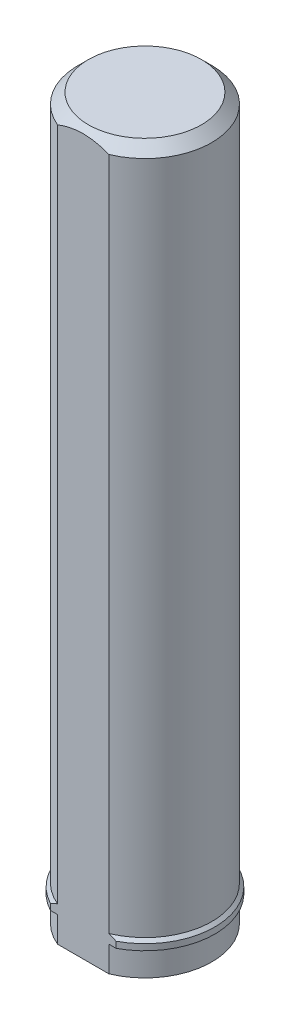
from build123d import *

# Parameters (mm, degrees)
BOSS_EXTRUDE1_DEPTH = 17.5
BOSS_EXTRUDE2_START = -1.75
BOSS_EXTRUDE2_DEPTH = 0.5
CHAMFER1_SIZE       = 0.2


with BuildPart() as part:
    # Sketch1 → Boss-Extrude1 (new, symmetric)
    with BuildSketch(Plane(origin=(0, 0, 0), x_dir=(1, 0, 0), z_dir=(0, 1, 0))):
        with BuildLine():
            Line((-1.25, -3), (1.25, -3))
            ThreePointArc((1.25, -3), (0, 3.25), (-1.25, -3))
        make_face()
    extrude(amount=BOSS_EXTRUDE1_DEPTH, both=True)

    # Sketch2 → Boss-Extrude2 (add)
    with BuildSketch(Plane.XZ.offset(17.5).offset(BOSS_EXTRUDE2_START)):
        with BuildLine():
            Line((-1.25, 3), (-1.6, 3))
            ThreePointArc((-1.6, 3), (0, -3.4), (1.6, 3))
            Line((1.6, 3), (1.25, 3))
            ThreePointArc((1.25, 3), (0, -3.25), (-1.25, 3))
        make_face()
    extrude(amount=BOSS_EXTRUDE2_DEPTH)

    # Chamfer1
    # the kernel refuses this chamfer: 0.2 mm, written as the material it takes off along each edge
    with BuildSketch(Plane(origin=(0, -15.75, 0), x_dir=(-0.3315887986155938, 0, 0.9434240131736458), z_dir=(0.9434240131736458, 0, 0.3315887986155938))) as chamfer1_piece_1_section:
        Polygon((3.4, CHAMFER1_SIZE), (3.4 - CHAMFER1_SIZE, 0), (3.4, 0), align=None)
    chamfer1_piece_1 = revolve(axis=Axis((0, -15.75, 0), (0, -1, 0)), revolution_arc=321.269525005, mode=Mode.PRIVATE)
    chamfer1_piece_1 = chamfer1_piece_1 - Plane(origin=(0, -15.75, 0), x_dir=(0.38461538461538497, 0, 0.923076923076923), z_dir=(0, 1, 0)) * Cylinder(3.25, 14, mode=Mode.PRIVATE)
    add(chamfer1_piece_1, mode=Mode.SUBTRACT)

    # Chamfer2: read off the stored shape, not the designer's step
    # Chamfer2 outline → Chamfer2 (revolve, cut)
    with BuildSketch(Plane.XY):
        Polygon((3.25, 17.5), (2.75, 17.5), (3.25, 17), align=None)
    revolve(axis=Axis((0, 0, 0), (0, 1, 0)), mode=Mode.SUBTRACT)


solid = part.part
